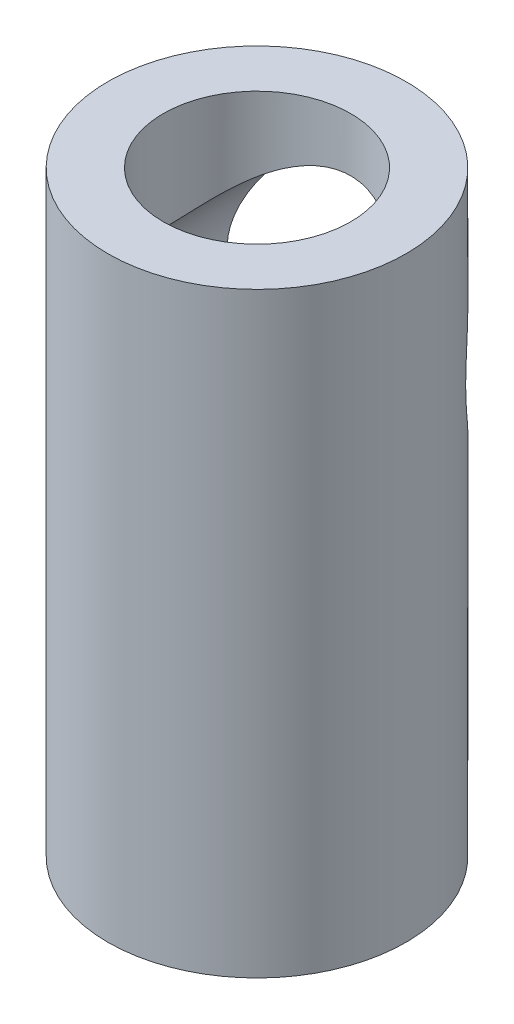
from build123d import *

# Parameters (mm, degrees)
SKETCH1_R           = 3.175
SKETCH1_R_2         = 1.99644
BOSS_EXTRUDE1_DEPTH = 12.7
SKETCH4_R           = 2.54
CUT_EXTRUDE1_DEPTH  = 3.175


with BuildPart() as part:
    # Sketch1 → Boss-Extrude1 (new body)
    with BuildSketch(Plane(origin=(0, 0, 0), x_dir=(1, 0, 0), z_dir=(0, 1, 0))):
        Circle(SKETCH1_R)
        Circle(SKETCH1_R_2, mode=Mode.SUBTRACT)
    extrude(amount=BOSS_EXTRUDE1_DEPTH)

    # Sketch4 → Cut-Extrude1 (cut)
    with BuildSketch(Plane(origin=(0, 12.7, -3.175), x_dir=(-1, 0, 0), z_dir=(0, 0, -1))):
        with Locations((0, -3.68808)):
            Circle(SKETCH4_R)
    extrude(amount=-CUT_EXTRUDE1_DEPTH, mode=Mode.SUBTRACT)


solid = part.part
